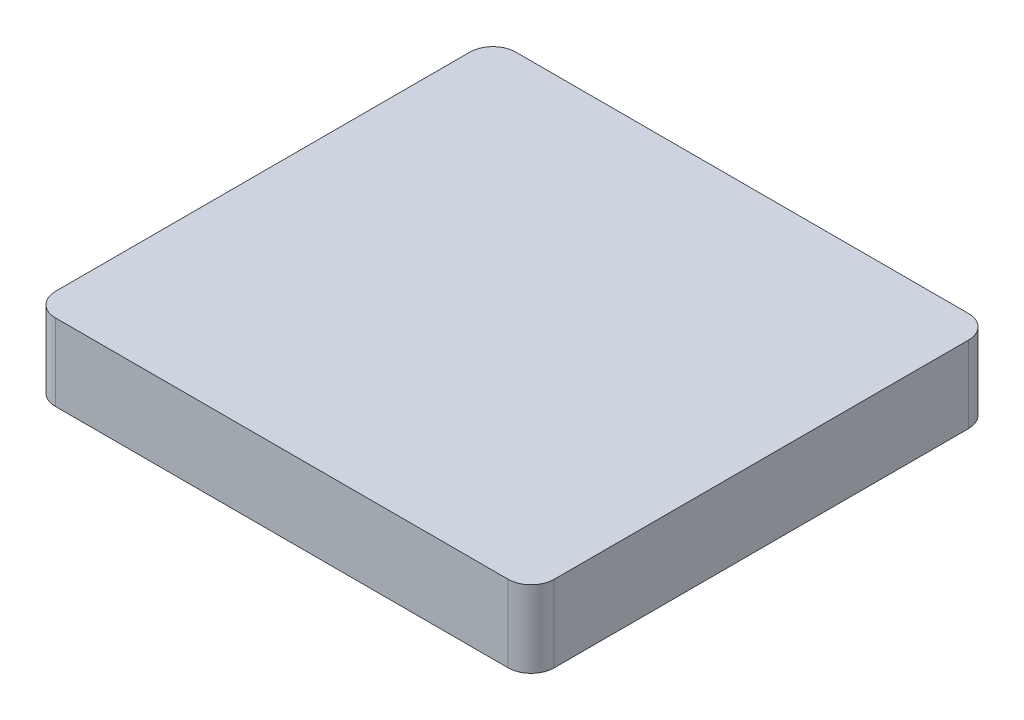
from build123d import *

# Parameters (mm, degrees)
SKETCH_1_W      = 65
SKETCH_1_H      = 60
EXTRUDE_1_DEPTH = 10
FILLET_1_R      = 3


with BuildPart() as part:
    # 草图1 → 凸台-拉伸1 (new body)
    with BuildSketch(Plane(origin=(0, 0, 0), x_dir=(1, 0, 0), z_dir=(0, 1, 0))):
        Rectangle(SKETCH_1_W, SKETCH_1_H)
    extrude(amount=EXTRUDE_1_DEPTH)

    # 圆角1
    fillet_1_edges = [part.edges().sort_by_distance(p)[0] for p in [
        (-32.5, 5, -30),
        (32.5, 5, -30),
        (32.5, 5, 30),
        (-32.5, 5, 30),
    ]]
    fillet(fillet_1_edges, radius=FILLET_1_R)


solid = part.part
